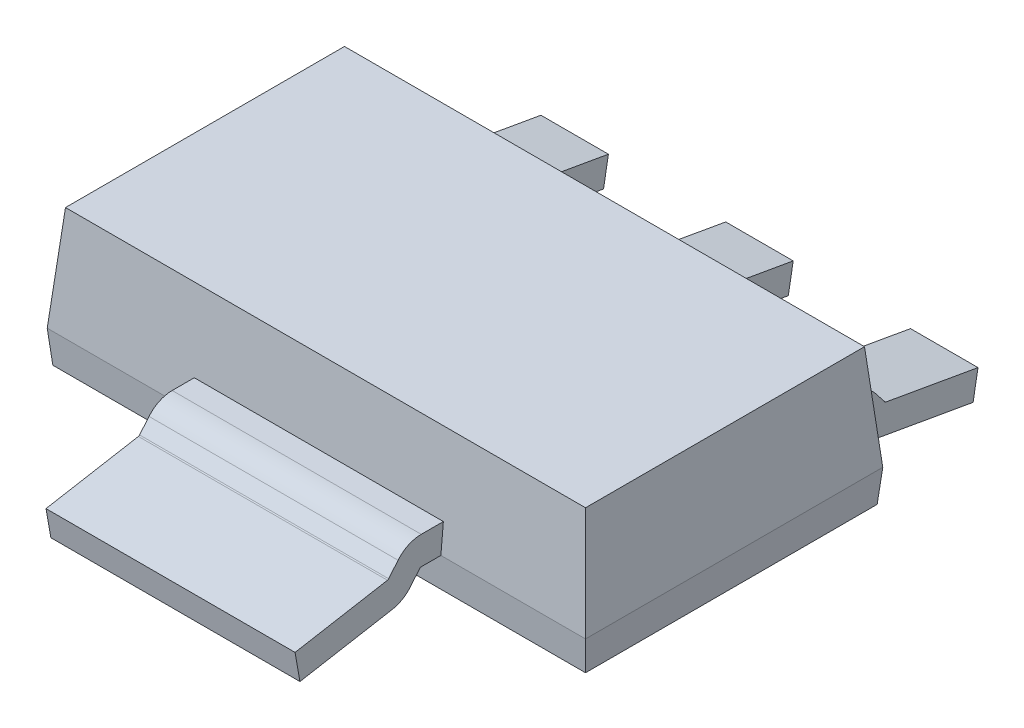
from build123d import *

# Parameters (mm, degrees)
CROQUIS1_W              = 6.7
CROQUIS1_H              = 3.7
SALIENTE_EXTRUIR1_DEPTH = 1.3
SALIENTE_EXTRUIR1_TAPER = 5
CROQUIS1_2_W            = 6.7
CROQUIS1_2_H            = 3.7
SALIENTE_EXTRUIR2_DEPTH = 0.4
SALIENTE_EXTRUIR2_DRAFT = -5
BARRER1_START           = -0.42
BARRER1_DEPTH           = 0.84
MATRIZL1_COUNT          = 2
MATRIZL1_PITCH          = 2.3
MATRIZL2_COUNT          = 2
MATRIZL2_PITCH          = 2.3
BARRER2_START           = -1.55
BARRER2_DEPTH           = 3.1


# Read off the part's stored shape, not the designer's step: Barrer1, Barrer2
with BuildPart() as part:
    # Croquis1 → Saliente-Extruir1 (new body)
    with BuildSketch(Plane(origin=(0, 0, 0), x_dir=(1, 0, 0), z_dir=(0, 1, 0))):
        Rectangle(CROQUIS1_W, CROQUIS1_H)
    extrude(amount=SALIENTE_EXTRUIR1_DEPTH, taper=SALIENTE_EXTRUIR1_TAPER)


with BuildPart() as saliente_extruir2_tool:
    # Croquis1<2> → Saliente-Extruir2 (with draft: the straight prism first)
    with BuildSketch(Plane(origin=(0, 0, 0), x_dir=(1, 0, 0), z_dir=(0, 1, 0))):
        Rectangle(CROQUIS1_2_W, CROQUIS1_2_H)
    extrude(amount=-SALIENTE_EXTRUIR2_DEPTH)
    # Saliente-Extruir2: the draft: its side faces are tilted about the plane it starts from
    saliente_extruir2_sides = [saliente_extruir2_tool.faces().sort_by_distance(p)[0] for p in [
        (-3.35, -0.2, 0),
        (0, -0.2, 1.85),
        (3.35, -0.2, 0),
        (0, -0.2, -1.85),
    ]]
    draft(saliente_extruir2_sides, Plane(origin=(0, 0, 0), x_dir=(1, 0, 0), z_dir=(0, 1, 0)), SALIENTE_EXTRUIR2_DRAFT)


with BuildPart() as part_1:
    add(part.part)

    # Saliente-Extruir2: add saliente_extruir2_tool
    add(saliente_extruir2_tool.part)

    # Barrer1 outline → Barrer1 (add)
    with BuildSketch(Plane.YZ.offset(BARRER1_START)):
        with BuildLine():
            Line((0.35, -2.098236587), (0.35, -1.819378968))
            Line((0.35, -1.819378968), (0, -1.85))
            Line((0, -1.85), (0, -2.098236587))
            ThreePointArc((0, -2.098236587), (-0.002534971, -2.109205747), (-0.009625798, -2.117950387))
            Line((-0.009625798, -2.117950387), (-0.151773886, -2.228807417))
            ThreePointArc((-0.151773886, -2.228807417), (-0.24251362, -2.331233787), (-0.290463768, -2.459396356))
            Line((-0.290463768, -2.459396356), (-0.492341357, -3.604301053))
            Line((-0.492341357, -3.604301053), (-0.147658643, -3.665077915))
            Line((-0.147658643, -3.665077915), (0.054218945, -2.520173218))
            ThreePointArc((0.054218945, -2.520173218), (0.057415622, -2.511629047), (0.063464937, -2.504800622))
            Line((0.063464937, -2.504800622), (0.205613025, -2.393943592))
            ThreePointArc((0.205613025, -2.393943592), (0.311975433, -2.262773993), (0.35, -2.098236587))
        make_face()
    barrer1 = extrude(amount=BARRER1_DEPTH)

    # MatrizL1: Barrer1 ×2
    with Locations(*[(-i * MATRIZL1_PITCH, 0, 0) for i in range(1, MATRIZL1_COUNT)]):
        add(barrer1)

    # MatrizL2: Barrer1 ×2
    with Locations(*[(i * MATRIZL2_PITCH, 0, 0) for i in range(1, MATRIZL2_COUNT)]):
        add(barrer1)

    # Barrer2 outline → Barrer2 (add)
    with BuildSketch(Plane.YZ.offset(BARRER2_START)):
        with BuildLine():
            Line((0.35, 1.819378968), (0.35, 2.094689484))
            ThreePointArc((0.35, 2.094689484), (0.314483055, 2.253988747), (0.214659972, 2.383112954))
            Line((0.214659972, 2.383112954), (0.073760247, 2.500190888))
            ThreePointArc((0.073760247, 2.500190888), (0.068117087, 2.506867054), (0.065117385, 2.515077915))
            Line((0.065117385, 2.515077915), (-0.137658643, 3.665077915))
            Line((-0.137658643, 3.665077915), (-0.482341357, 3.604301053))
            Line((-0.482341357, 3.604301053), (-0.279565329, 2.454301053))
            ThreePointArc((-0.279565329, 2.454301053), (-0.234569796, 2.33113814), (-0.149922393, 2.23099565))
            Line((-0.149922393, 2.23099565), (-0.009022669, 2.113917715))
            ThreePointArc((-0.009022669, 2.113917715), (-0.002367796, 2.105309435), (0, 2.094689484))
            Line((0, 2.094689484), (0, 1.85))
            Line((0, 1.85), (0.35, 1.819378968))
        make_face()
    extrude(amount=BARRER2_DEPTH)


solid = part_1.part
